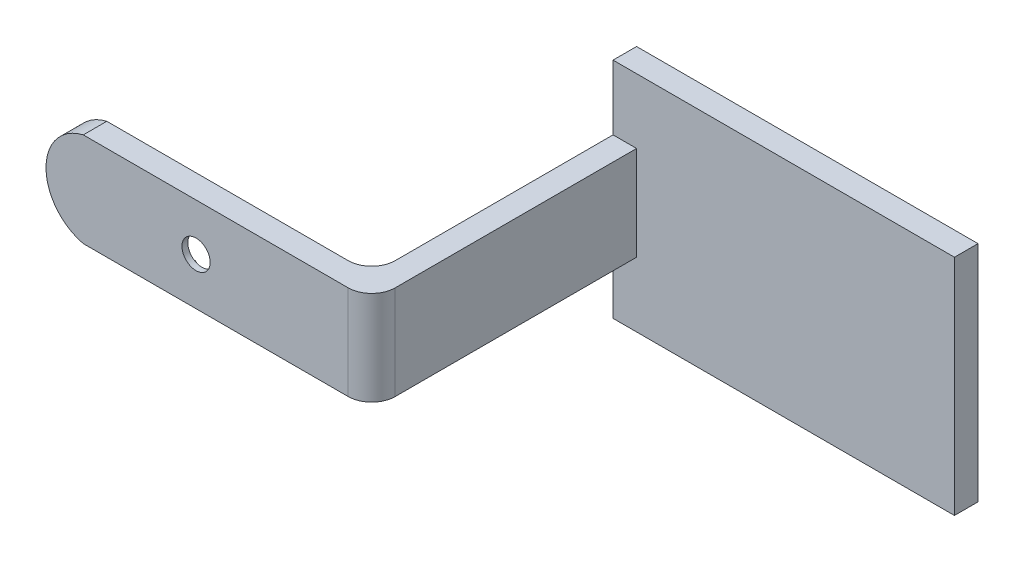
from build123d import *

# Parameters (mm, degrees)
BOSS_EXTRUDE1_DEPTH  = 4
CUT_EXTRUDE1_DEPTH   = 3
SKETCH5_W            = 49
SKETCH5_H            = 16
BOSS_EXTRUDE2_DEPTH  = 4
BOSS_EXTRUDE15_DEPTH = 4
SKETCH20_R           = 2.4
CUT_EXTRUDE26_DEPTH  = 1
FILLET8_R            = 4
FILLET12_R           = 4


with BuildPart() as part:
    # Sketch2 → Boss-Extrude1 (new body)
    with BuildSketch(Plane.XY):
        with BuildLine():
            Line((23.733047461, 11.63962887), (23.733047461, -4.36037113))
            Line((23.733047461, -4.36037113), (-21.266952539, -4.36037113))
            ThreePointArc((-21.266952539, -4.36037113), (-27.597931628, 3.63962887), (-21.266952539, 11.63962887))
            Line((-21.266952539, 11.63962887), (23.733047461, 11.63962887))
        make_face()
    extrude(amount=BOSS_EXTRUDE1_DEPTH)

    # Sketch1 → Cut-Extrude1 (cut)
    with BuildSketch(Plane.XY):
        with BuildLine():
            Line((-6.25004119, 8.63962887), (-20.04279291, 6.23962887))
            ThreePointArc((-20.04279291, 6.23962887), (-22.105421524, 3.63962887), (-20.04279291, 1.03962887))
            Line((-20.04279291, 1.03962887), (-6.25004119, -1.36037113))
            ThreePointArc((-6.25004119, -1.36037113), (-2.105421524, -2.86037113), (2.039198142, -1.36037113))
            Line((2.039198142, -1.36037113), (15.831949862, 1.03962887))
            ThreePointArc((15.831949862, 1.03962887), (17.894578476, 3.63962887), (15.831949862, 6.23962887))
            Line((15.831949862, 6.23962887), (2.039198142, 8.63962887))
            ThreePointArc((2.039198142, 8.63962887), (-2.105421524, 10.13962887), (-6.25004119, 8.63962887))
        make_face()
    extrude(amount=CUT_EXTRUDE1_DEPTH, mode=Mode.SUBTRACT)

    # Sketch5 → Boss-Extrude2 (add)
    with BuildSketch(Plane(origin=(23.733047461, 0, 0), x_dir=(0, 0, -1), z_dir=(1, 0, 0))):
        with Locations((20.5, 3.63962887)):
            Rectangle(SKETCH5_W, SKETCH5_H)
    extrude(amount=BOSS_EXTRUDE2_DEPTH)

    # Sketch6 → Boss-Extrude15 (add)
    with BuildSketch(Plane(origin=(0, 0, -45), x_dir=(-1, 0, 0), z_dir=(0, 0, -1))):
        Polygon((-30.946192459, -15.36037113), (-81.733047461, -15.36037113), (-81.733047461, 22.63962887), (-23.733047461, 22.63962887), (-23.733047461, -15.36037113), align=None)
    extrude(amount=-BOSS_EXTRUDE15_DEPTH)

    # Sketch20 → Cut-Extrude26 (cut)
    with BuildSketch(Plane(origin=(0, 0, 3), x_dir=(-1, 0, 0), z_dir=(0, 0, -1))):
        with Locations((2.105421524, 3.63962887)):
            Circle(SKETCH20_R)
    extrude(amount=-CUT_EXTRUDE26_DEPTH, mode=Mode.SUBTRACT)

    # Fillet8
    fillet8_edges = [part.edges().sort_by_distance(p)[0] for p in [
        (23.733047461, 3.63962887, 0),
    ]]
    fillet(fillet8_edges, radius=FILLET8_R)

    # Fillet12
    fillet12_edges = [part.edges().sort_by_distance(p)[0] for p in [
        (27.733047461, 3.63962887, 4),
    ]]
    fillet(fillet12_edges, radius=FILLET12_R)


solid = part.part
